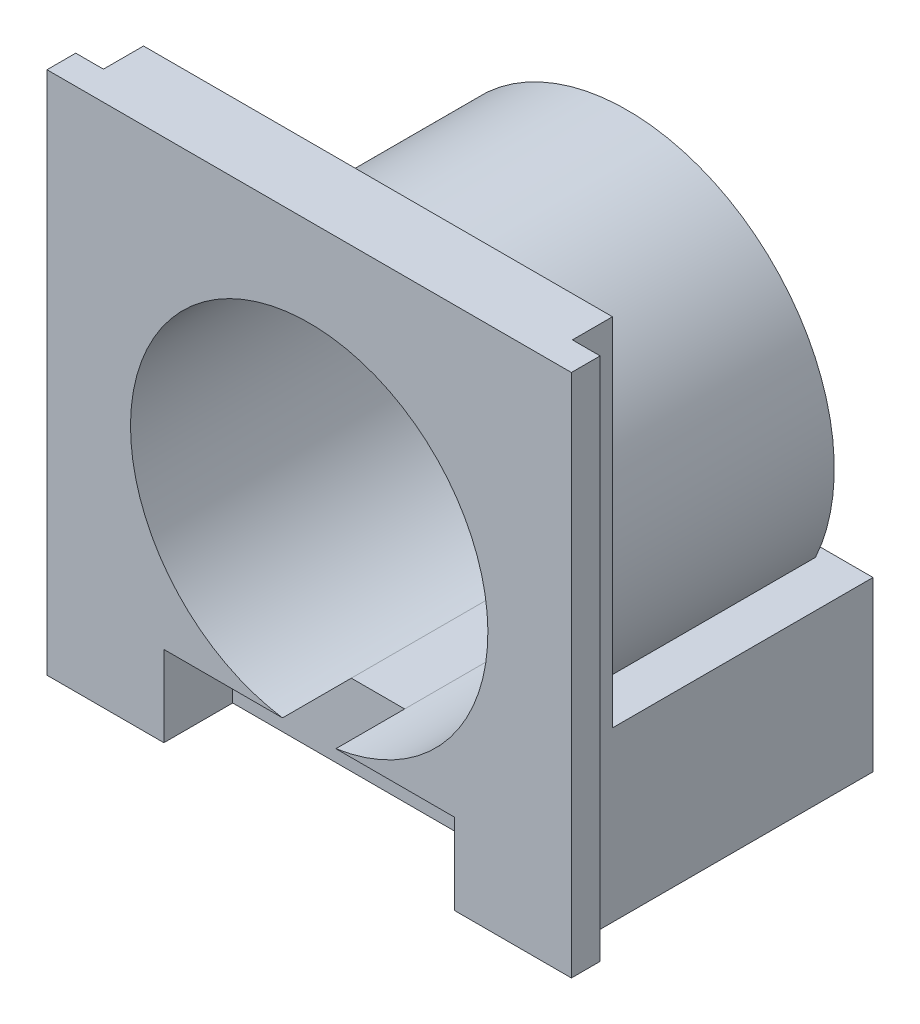
from build123d import *

# Parameters (mm, degrees)
BOSS_EXTRUDE1_DEPTH = 6.4008
BOSS_EXTRUDE2_DEPTH = 19.939
SKETCH1_4_W         = 11.049
SKETCH1_4_H         = 2.6162
CUT_EXTRUDE1_DEPTH  = 3.0734
SKETCH2_R           = 7.874
BOSS_EXTRUDE3_DEPTH = 9.4742
CUT_EXTRUDE2_DEPTH  = 10.16


with BuildPart() as part:
    # Sketch1 → Boss-Extrude1 (new body)
    with BuildSketch(Plane(origin=(0, 0, 0), x_dir=(1, 0, 0), z_dir=(0, 1, 0))):
        Polygon((1.678214286, -1.50495), (5.069114286, -1.50495), (5.069114286, 8.40105), (-12.761685714, 8.40105), (-12.761685714, -1.50495), (-9.370785714, -1.50495), (-9.370785714, -4.12115), (1.678214286, -4.12115), align=None)
    extrude(amount=BOSS_EXTRUDE1_DEPTH)

    # Sketch1<3> → Boss-Extrude2 (add)
    with BuildSketch(Plane(origin=(0, 0, 0), x_dir=(1, 0, 0), z_dir=(0, 1, 0))):
        Polygon((5.069114286, -3.02895), (5.069114286, -1.50495), (-12.761685714, -1.50495), (-12.761685714, -3.02895), (-13.815785714, -3.02895), (-13.815785714, -4.12115), (6.123214286, -4.12115), (6.123214286, -3.02895), align=None)
    extrude(amount=BOSS_EXTRUDE2_DEPTH)

    # Sketch1<4> → Cut-Extrude1 (cut)
    with BuildSketch(Plane(origin=(0, 0, 0), x_dir=(1, 0, 0), z_dir=(0, 1, 0))):
        with Locations((-3.846285714, -2.81305)):
            Rectangle(SKETCH1_4_W, SKETCH1_4_H)
    extrude(amount=CUT_EXTRUDE1_DEPTH, mode=Mode.SUBTRACT)

    # Sketch2 → Boss-Extrude3 (add)
    with BuildSketch(Plane(origin=(0, 0, 1.50495), x_dir=(-1, 0, 0), z_dir=(0, 0, -1))):
        with Locations((3.846285714, 9.6774)):
            Circle(SKETCH2_R)
    extrude(amount=BOSS_EXTRUDE3_DEPTH)

    # Sketch3 → Cut-Extrude2 (cut)
    with BuildSketch(Plane.XY.offset(4.12115)):
        with BuildLine():
            ThreePointArc((-2.831556509, 3.0734), (1.304433063, 5.360523369), (2.948214286, 9.7917))
            ThreePointArc((2.948214286, 9.7917), (0.95815131, 14.596137025), (-3.846285714, 16.5862))
            ThreePointArc((-3.846285714, 16.5862), (-10.621708934, 10.300493131), (-4.86101492, 3.0734))
            Line((-4.86101492, 3.0734), (-2.831556509, 3.0734))
        make_face()
    extrude(amount=-CUT_EXTRUDE2_DEPTH, mode=Mode.SUBTRACT)


solid = part.part
